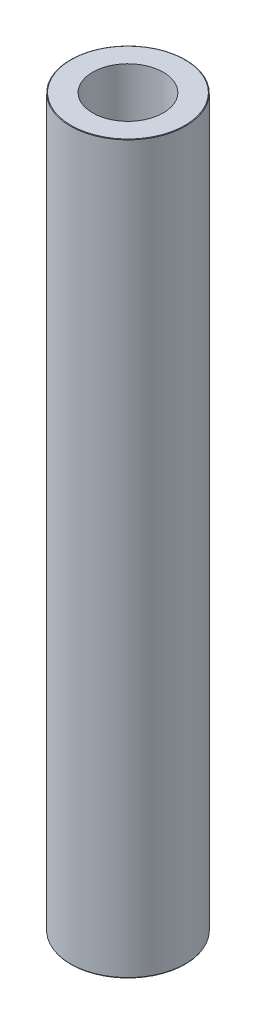
from build123d import *
from OCP.BRepFilletAPI import BRepFilletAPI_MakeChamfer

# Parameters (mm, degrees)
SKETCH1_R           = 47.5
BOSS_EXTRUDE1_DEPTH = 600
SKETCH2_R           = 29.157727097
CUT_EXTRUDE1_DEPTH  = 604.748706003
CHAMFER1_SIZE       = 0.286411648
CHAMFER1_SIZE2      = 0.508944412


with BuildPart() as part:
    # Sketch1 → Boss-Extrude1 (new body)
    with BuildSketch(Plane(origin=(0, 0, 0), x_dir=(1, 0, 0), z_dir=(0, 1, 0))):
        Circle(SKETCH1_R)
    extrude(amount=BOSS_EXTRUDE1_DEPTH)

    # Sketch2 → Cut-Extrude1 (cut, through all)
    with BuildSketch(Plane(origin=(0, 0, 0), x_dir=(1, 0, 0), z_dir=(0, 1, 0))):
        Circle(SKETCH2_R)
    extrude(amount=CUT_EXTRUDE1_DEPTH, mode=Mode.SUBTRACT)

    # Chamfer1: one chamfer whose edges measure the first distance from different faces: ONE call of the kernel's chamfer builder (chamfer() names one face for all edges)
    chamfer1_edges_1 = [part.edges().sort_by_distance(p)[0] for p in [
        (-47.5, 600, 0),
    ]]
    chamfer1_side_1 = [part.faces().sort_by_distance(p)[0] for p in [
        (-47.5, 300, 0),
    ]]
    chamfer1_edges_2 = [part.edges().sort_by_distance(p)[0] for p in [
        (-47.5, 0, 0),
    ]]
    chamfer1_side_2 = [part.faces().sort_by_distance(p)[0] for p in [
        (-46.156497116, 0, 0),
    ]]
    chamfer1 = BRepFilletAPI_MakeChamfer(part.part.solid().wrapped)
    for e in chamfer1_edges_1:
        chamfer1.Add(CHAMFER1_SIZE, CHAMFER1_SIZE2, e.wrapped, chamfer1_side_1[0].wrapped)  # the first distance lies on this face
    for e in chamfer1_edges_2:
        chamfer1.Add(CHAMFER1_SIZE, CHAMFER1_SIZE2, e.wrapped, chamfer1_side_2[0].wrapped)  # the first distance lies on this face
    add(Compound.cast(chamfer1.Shape()), mode=Mode.REPLACE)


solid = part.part
